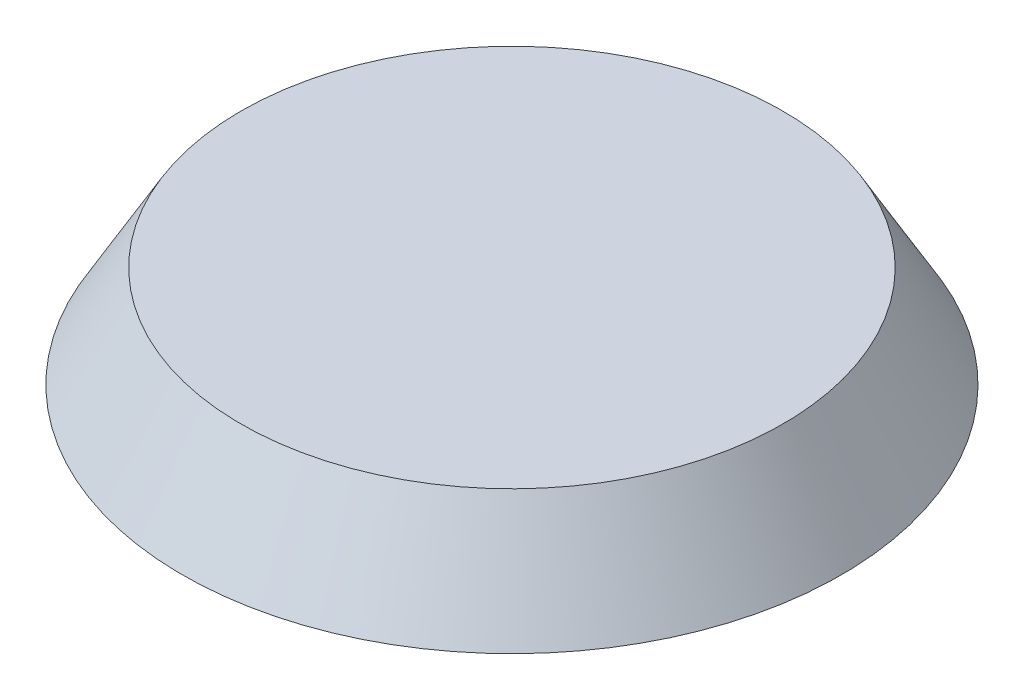
from build123d import *

# Parameters (mm, degrees)
SKETCH2_R           = 54.4425
BOSS_EXTRUDE1_DEPTH = 5


with BuildPart() as part:
    # Sketch2 → Boss-Extrude1 (new body)
    with BuildSketch(Plane(origin=(0, 0, 0), x_dir=(1, 0, 0), z_dir=(0, 1, 0))):
        Circle(SKETCH2_R)
    extrude(amount=BOSS_EXTRUDE1_DEPTH)

    # Sketch4 → Revolve1 (revolve)
    with BuildSketch(Plane.XY):
        Polygon((0, 5), (65, 5), (53.452994616, 25), (0, 25), align=None)
    revolve(axis=Axis((0, 25, 0), (0, -1, 0)))


solid = part.part
